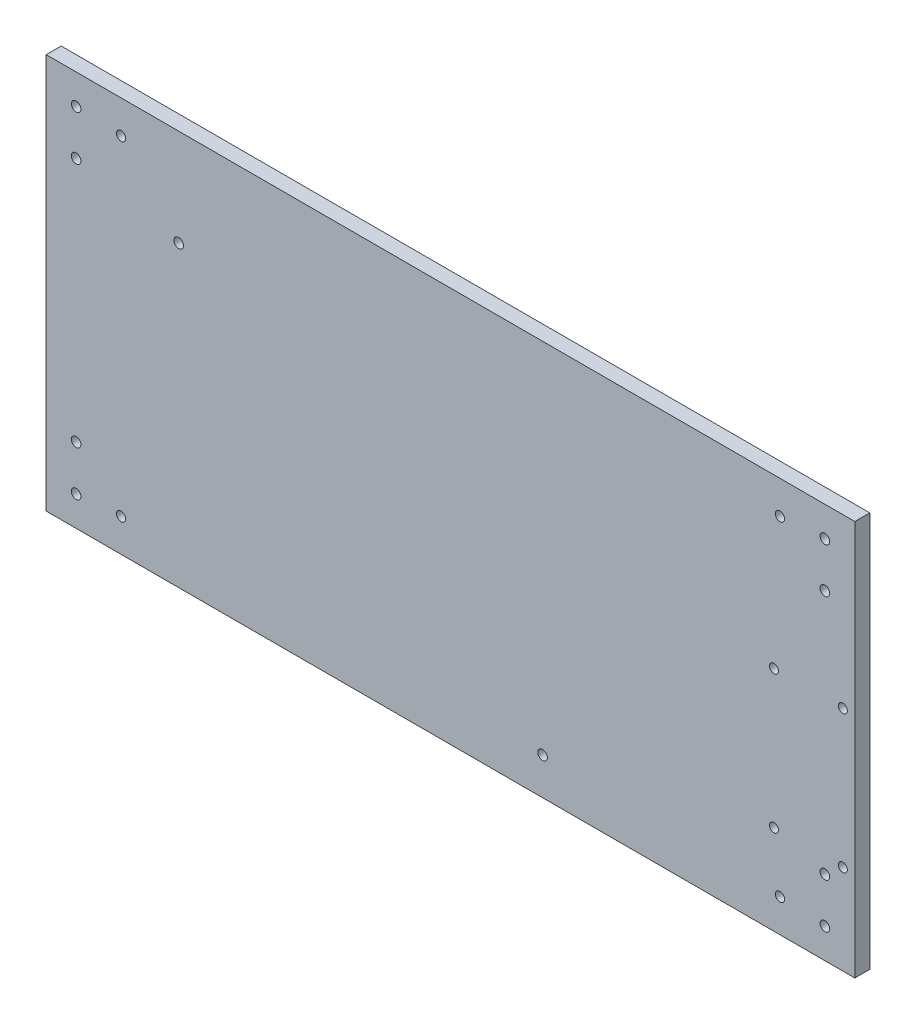
from build123d import *

# Parameters (mm, degrees)
SKETCH1_W                  = 270
SKETCH1_H                  = 132
BASE_DEPTH                 = 2.5
SKETCH3_R                  = 1.6
PSUMOUNT_DEPTH             = 151.352918163
SKETCH4_R                  = 1.5
INTERFACEHOLES_DEPTH       = 151.352918163
SKETCH5_R                  = 1.55
CUT_EXTRUDE2_DEPTH         = 151.352918163
F_3_2_3_2_WALLMOUNTHOLES_D = 3.2


with BuildPart() as part:
    # Sketch1 → Base (new, symmetric)
    with BuildSketch(Plane.XY):
        Rectangle(SKETCH1_W, SKETCH1_H)
    extrude(amount=BASE_DEPTH, both=True)

    # Sketch3 → PSUMount (cut, through all)
    with BuildSketch(Plane(origin=(0, 0, -2.5), x_dir=(-1, 0, 0), z_dir=(0, 0, -1))):
        with Locations((-30.75, -53.65)):
            Circle(SKETCH3_R)
        with Locations((90.75, 33.65)):
            Circle(SKETCH3_R)
    extrude(amount=-PSUMOUNT_DEPTH, mode=Mode.SUBTRACT)

    # Sketch4 → InterfaceHoles (cut, through all)
    with BuildSketch(Plane.XY.offset(2.5)):
        with Locations((108, 10)):
            Circle(SKETCH4_R)
        with Locations((131, 10)):
            Circle(SKETCH4_R)
        with Locations((108, -36)):
            Circle(SKETCH4_R)
        with Locations((131, -36)):
            Circle(SKETCH4_R)
    extrude(amount=-INTERFACEHOLES_DEPTH, mode=Mode.SUBTRACT)

    # Sketch5 → Cut-Extrude2 (cut, through all)
    with BuildSketch(Plane.XY.offset(2.5)):
        with Locations((-110, -55)):
            Circle(SKETCH5_R)
        with Locations((-110, 55)):
            Circle(SKETCH5_R)
        with Locations((110, 55)):
            Circle(SKETCH5_R)
        with Locations((110, -55)):
            Circle(SKETCH5_R)
    extrude(amount=-CUT_EXTRUDE2_DEPTH, mode=Mode.SUBTRACT)

    # Ø3.2 (3.2) WallMountHoles (through all)
    with Locations(Plane.XY.offset(2.5)):
        with Locations((-125, 56), (-125, 41), (-125, -41), (-125, -56), (125, -56), (125, -41), (125, 41), (125, 56)):
            Hole(F_3_2_3_2_WALLMOUNTHOLES_D / 2)


solid = part.part
